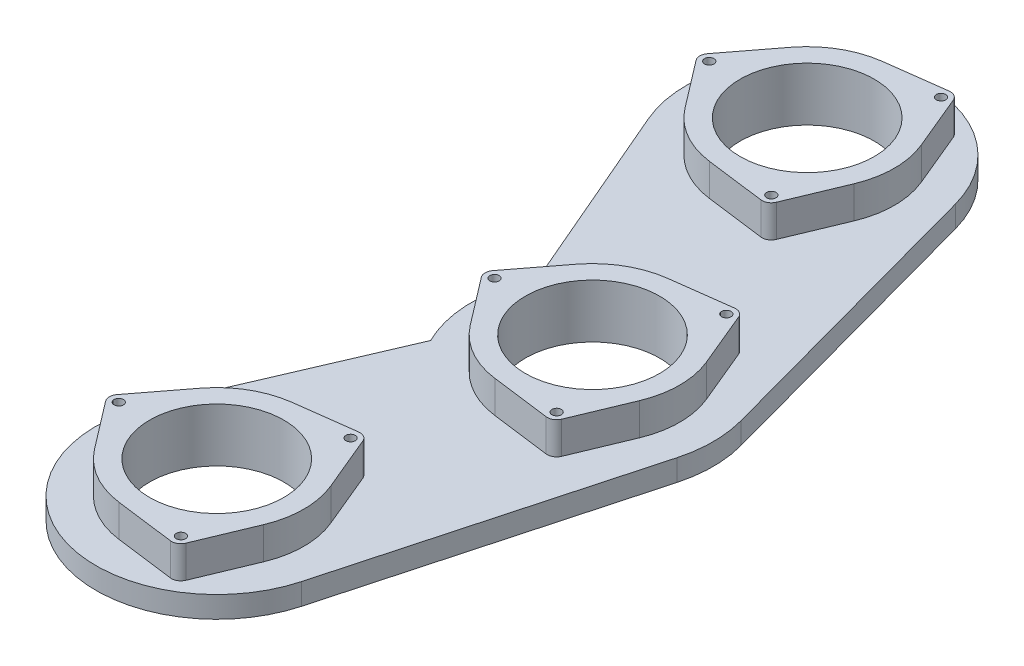
from build123d import *

# Parameters (mm, degrees)
SALIENTE_EXTRUIR1_DEPTH    = 8
SALIENTE_EXTRUIR2_DEPTH    = 12
CORTAR_EXTRUIR3_DEPTH      = 173.609385608
CORTAR_EXTRUIR3_DEPTH_BACK = 173.609385608
CROQUIS7_R                 = 25
CROQUIS7_R_2               = 1.75


with BuildPart() as part:
    # Croquis1 → Saliente-Extruir1 (new body)
    with BuildSketch(Plane(origin=(0, 0, 0), x_dir=(1, 0, 0), z_dir=(0, 1, 0))):
        with BuildLine():
            Line((-71.345800689, 92.236983213), (-40.311288741, 20))
            ThreePointArc((-40.311288741, 20), (-45, 0), (-40.311288741, -20))
            Line((-40.311288741, -20), (-71.345800689, -92.236983213))
            ThreePointArc((-71.345800689, -92.236983213), (-44.837742086, -152.483425118), (13.414371956, -121.840283261))
            Line((13.414371956, -121.840283261), (43.414371956, -11.840283261))
            ThreePointArc((43.414371956, -11.840283261), (45, 0), (43.414371956, 11.840283261))
            Line((43.414371956, 11.840283261), (13.414371956, 121.840283261))
            ThreePointArc((13.414371956, 121.840283261), (-44.837742086, 152.483425118), (-71.345800689, 92.236983213))
        make_face()
    extrude(amount=SALIENTE_EXTRUIR1_DEPTH)

    # Croquis6 → Saliente-Extruir2 (add)
    with BuildSketch(Plane(origin=(0, 8, 0), x_dir=(1, 0, 0), z_dir=(0, 1, 0))):
        with BuildLine():
            Line((-39.280821918, 2.125330436), (-25.821917808, 19.73521119))
            ThreePointArc((-25.821917808, 19.73521119), (-16.25, 28.145825623), (-4.180235335, 32.230042391))
            Line((-4.180235335, 32.230042391), (17.79982081, 35.08085488))
            ThreePointArc((17.79982081, 35.08085488), (20, 34.641016151), (21.481001108, 32.955524444))
            Line((21.481001108, 32.955524444), (30.002153144, 12.494831201))
            ThreePointArc((30.002153144, 12.494831201), (32.5, 0), (30.002153144, -12.494831201))
            Line((30.002153144, -12.494831201), (21.481001108, -32.955524444))
            ThreePointArc((21.481001108, -32.955524444), (20, -34.641016151), (17.79982081, -35.08085488))
            Line((17.79982081, -35.08085488), (-4.180235335, -32.230042391))
            ThreePointArc((-4.180235335, -32.230042391), (-16.25, -28.145825623), (-25.821917808, -19.73521119))
            Line((-25.821917808, -19.73521119), (-39.280821918, -2.125330436))
            ThreePointArc((-39.280821918, -2.125330436), (-40, 0), (-39.280821918, 2.125330436))
        make_face()
        with BuildLine():
            Line((-69.280821918, -107.874669564), (-55.821917808, -90.26478881))
            ThreePointArc((-55.821917808, -90.26478881), (-46.25, -81.854174377), (-34.180235335, -77.769957609))
            Line((-34.180235335, -77.769957609), (-12.20017919, -74.91914512))
            ThreePointArc((-12.20017919, -74.91914512), (-10, -75.358983849), (-8.518998892, -77.044475556))
            Line((-8.518998892, -77.044475556), (0.002153144, -97.505168799))
            ThreePointArc((0.002153144, -97.505168799), (2.5, -110), (0.002153144, -122.494831201))
            Line((0.002153144, -122.494831201), (-8.518998892, -142.955524444))
            ThreePointArc((-8.518998892, -142.955524444), (-10, -144.641016151), (-12.20017919, -145.08085488))
            Line((-12.20017919, -145.08085488), (-34.180235335, -142.230042391))
            ThreePointArc((-34.180235335, -142.230042391), (-46.25, -138.145825623), (-55.821917808, -129.73521119))
            Line((-55.821917808, -129.73521119), (-69.280821918, -112.125330436))
            ThreePointArc((-69.280821918, -112.125330436), (-70, -110), (-69.280821918, -107.874669564))
        make_face()
        with BuildLine():
            Line((-69.280821918, 107.874669564), (-55.821917808, 90.26478881))
            ThreePointArc((-55.821917808, 90.26478881), (-46.25, 81.854174377), (-34.180235335, 77.769957609))
            Line((-34.180235335, 77.769957609), (-12.20017919, 74.91914512))
            ThreePointArc((-12.20017919, 74.91914512), (-10, 75.358983849), (-8.518998892, 77.044475556))
            Line((-8.518998892, 77.044475556), (0.002153144, 97.505168799))
            ThreePointArc((0.002153144, 97.505168799), (2.5, 110), (0.002153144, 122.494831201))
            Line((0.002153144, 122.494831201), (-8.518998892, 142.955524444))
            ThreePointArc((-8.518998892, 142.955524444), (-10, 144.641016151), (-12.20017919, 145.08085488))
            Line((-12.20017919, 145.08085488), (-34.180235335, 142.230042391))
            ThreePointArc((-34.180235335, 142.230042391), (-46.25, 138.145825623), (-55.821917808, 129.73521119))
            Line((-55.821917808, 129.73521119), (-69.280821918, 112.125330436))
            ThreePointArc((-69.280821918, 112.125330436), (-70, 110), (-69.280821918, 107.874669564))
        make_face()
    extrude(amount=SALIENTE_EXTRUIR2_DEPTH)

    # Croquis7 → Cortar-Extruir3 (cut, two sides: drawn at the far end of the back side and taken through both)
    with BuildSketch(Plane(origin=(0, 8, 0), x_dir=(1, 0, 0), z_dir=(0, 1, 0)).offset(-CORTAR_EXTRUIR3_DEPTH_BACK)):
        Circle(CROQUIS7_R)
        with Locations((-30, 110)):
            Circle(CROQUIS7_R)
        with Locations((-30, -110)):
            Circle(CROQUIS7_R)
        with Locations((-36.5, 0)):
            Circle(CROQUIS7_R_2)
        with Locations((18.25, -31.609927238)):
            Circle(CROQUIS7_R_2)
        with Locations((18.25, 31.609927238)):
            Circle(CROQUIS7_R_2)
        with Locations((-11.75, 141.609927238)):
            Circle(CROQUIS7_R_2)
        with Locations((-66.5, 110)):
            Circle(CROQUIS7_R_2)
        with Locations((-11.75, 78.390072762)):
            Circle(CROQUIS7_R_2)
        with Locations((-66.5, -110)):
            Circle(CROQUIS7_R_2)
        with Locations((-11.75, -141.609927238)):
            Circle(CROQUIS7_R_2)
        with Locations((-11.75, -78.390072762)):
            Circle(CROQUIS7_R_2)
    extrude(amount=CORTAR_EXTRUIR3_DEPTH + CORTAR_EXTRUIR3_DEPTH_BACK, mode=Mode.SUBTRACT)


solid = part.part
